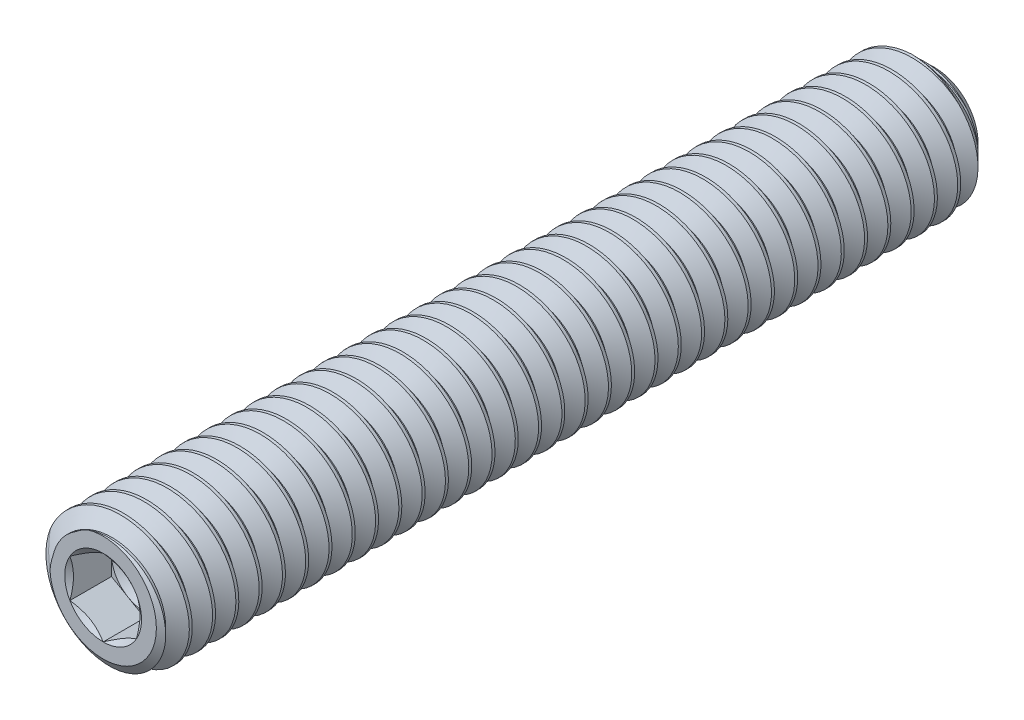
from build123d import *

# Parameters (mm, degrees)
CUT_SWEEP2_PITCH    = 0.7
CUT_EXTRUDE10_DEPTH = 1.25


with BuildPart() as part:
    # Sketch22 → Revolve1 (revolve)
    with BuildSketch(Plane(origin=(0, 0, 0), x_dir=(0, 0, -1), z_dir=(1, 0, 0)), mode=Mode.PRIVATE) as revolve1_sk:
        Polygon((-12.5, 0), (-12.5, 1.6), (-12.219916985, 2), (11.8, 2), (12.5, 1.3), (12.5, 0), align=None)
    revolve(revolve1_sk.sketch.rotate(Axis((0, 0, -12.5), (0, 0, 1)), 90), axis=Axis((0, 0, -12.5), (0, 0, 1)))

    # Cut-Sweep2: arcs per turn and ends read off the stored shape
    # Cut-Sweep2: the profile of Sketch28 profile screwed along a right-hand helix through 36.714286 turns, 6 arcs to a turn; built about Z, then put on its axis
    cut_sweep2_z = Axis((0, 0, 0), (0, 0, 1))
    cut_sweep2_corners = [(2.0003, 0, 0.000173205), (2.0003, 0, -0.612673205), (1.545336663, 0, -0.35), (1.545336663, 0, -0.2625)]
    with BuildLine(mode=Mode.PRIVATE) as cut_sweep2_profile:
        Line(cut_sweep2_corners[0], cut_sweep2_corners[1])
        Line(cut_sweep2_corners[1], cut_sweep2_corners[2])
        Line(cut_sweep2_corners[2], cut_sweep2_corners[3])
        Line(cut_sweep2_corners[3], cut_sweep2_corners[0])
    cut_sweep2_cap = Face(cut_sweep2_profile.wire())
    cut_sweep2_turn_angles = [0, 30, 60, 90, 120, 150, 180, 210, 240, 270, 300, 330, 360]
    cut_sweep2_turn_weights = [1, 0.8660254037844387, 1, 0.8660254037844387, 1, 0.8660254037844387, 1, 0.8660254037844387, 1, 0.8660254037844387, 1, 0.8660254037844387, 1]
    cut_sweep2_turn_rails = [Edge.make_bspline([Vector(p[0], p[1], 0).rotate(cut_sweep2_z, cut_sweep2_turn_angles[k]) / cut_sweep2_turn_weights[k] + Vector(0, 0, p[2] + CUT_SWEEP2_PITCH * cut_sweep2_turn_angles[k] / 360) for k in range(13)], [0, 0, 0, 1, 1, 2, 2, 3, 3, 4, 4, 5, 5, 6, 6, 6], 2, cut_sweep2_turn_weights) for p in cut_sweep2_corners]
    cut_sweep2_turn_sides = [Face.make_surface_from_curves(cut_sweep2_turn_rails[p[0]], cut_sweep2_turn_rails[p[1]]) for p in [(0, 1), (1, 2), (2, 3), (3, 0)]]
    cut_sweep2_last_angles = [12960, 12990, 13020, 13050, 13080, 13110, 13140, 13170, 13200, 13208.571428571, 13217.142857142]
    cut_sweep2_last_weights = [1, 0.8660254037844387, 1, 0.8660254037844387, 1, 0.8660254037844387, 1, 0.8660254037844387, 1, 0.9888308262257346, 1]
    cut_sweep2_last_rails = [Edge.make_bspline([Vector(p[0], p[1], 0).rotate(cut_sweep2_z, cut_sweep2_last_angles[k]) / cut_sweep2_last_weights[k] + Vector(0, 0, p[2] + CUT_SWEEP2_PITCH * cut_sweep2_last_angles[k] / 360) for k in range(11)], [0, 0, 0, 1, 1, 2, 2, 3, 3, 4, 4, 5, 5, 5], 2, cut_sweep2_last_weights) for p in cut_sweep2_corners]
    cut_sweep2_last_sides = [Face.make_surface_from_curves(cut_sweep2_last_rails[p[0]], cut_sweep2_last_rails[p[1]]) for p in [(0, 1), (1, 2), (2, 3), (3, 0)]]
    cut_sweep2 = Plane(origin=(0, 0, -12.5), x_dir=(0, 1, 0), z_dir=(0, 0, 1)) * Solid(Shell([*[p.moved(Location((0, 0, CUT_SWEEP2_PITCH * i))) for i in range(36) for p in cut_sweep2_turn_sides], *cut_sweep2_last_sides, cut_sweep2_cap, cut_sweep2_cap.rotate(cut_sweep2_z, 13217.142857142).moved(Location((0, 0, CUT_SWEEP2_PITCH * 13217.142857142 / 360)))]))
    add(cut_sweep2, mode=Mode.SUBTRACT)

    # Sketch23 → Cut-Extrude10 (cut)
    with BuildSketch(Plane.XY.offset(12.5)):
        Polygon((0, 1.154700538), (-1, 0.577350269), (-1, -0.577350269), (0, -1.154700538), (1, -0.577350269), (1, 0.577350269), align=None)
    extrude(amount=-CUT_EXTRUDE10_DEPTH, mode=Mode.SUBTRACT)

    # Cut-Extrude11 cone 1 section (through the dimple's axis) → Cut-Extrude11 (revolve, cut)
    with BuildSketch(Plane(origin=(0, 0, 12.5), x_dir=(0, -1, 0), z_dir=(1, 0, 0))):
        Polygon((0, 0), (1.154700538, 0), (0, 0.808530021), align=None)
    revolve(axis=Axis((0, 0, 12.5), (0, 0, -1)), mode=Mode.SUBTRACT)

    # Cut-Extrude12 cone 1 section (through the dimple's axis) → Cut-Extrude12 (revolve, cut)
    with BuildSketch(Plane(origin=(0, 0, 11.25), x_dir=(0, -1, 0), z_dir=(1, 0, 0))):
        Polygon((0, 0), (1, 0), (0, 0.577350269), align=None)
    revolve(axis=Axis((0, 0, 11.25), (0, 0, -1)), mode=Mode.SUBTRACT)


solid = part.part
